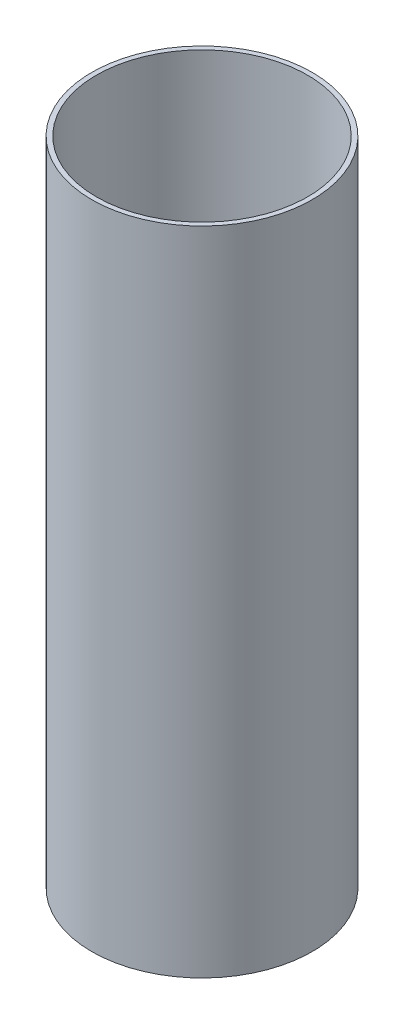
from build123d import *

# Parameters (mm, degrees)
SKETCH1_R           = 38.1
SKETCH1_R_2         = 36.47
BOSS_EXTRUDE1_DEPTH = 225


with BuildPart() as part:
    # Sketch1 → Boss-Extrude1 (new body)
    with BuildSketch(Plane(origin=(0, 0, 0), x_dir=(1, 0, 0), z_dir=(0, 1, 0))):
        Circle(SKETCH1_R)
        Circle(SKETCH1_R_2, mode=Mode.SUBTRACT)
    extrude(amount=BOSS_EXTRUDE1_DEPTH)


solid = part.part
